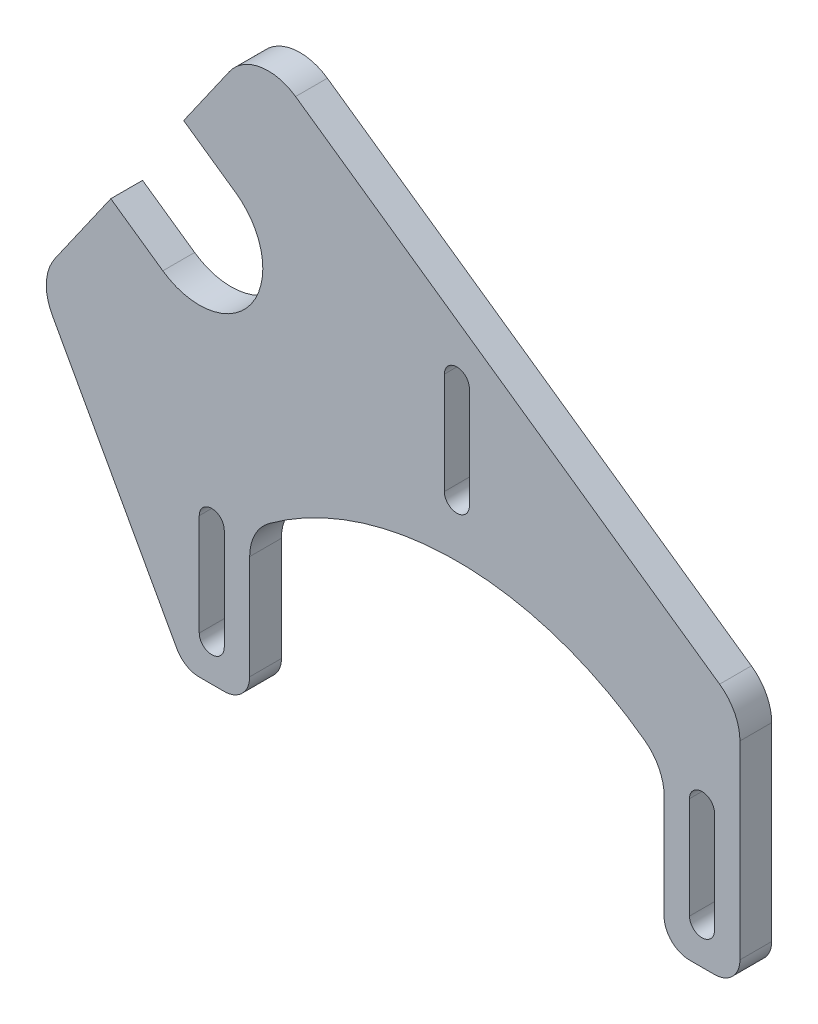
from build123d import *

# Parameters (mm, degrees)
EXTRUDE1_DEPTH     = 6.35
CUT_EXTRUDE3_REACH = 130.919
FILLET1_R          = 9.525


with BuildPart() as part:
    # Sketch1 → Extrude1 (new body)
    with BuildSketch(Plane.XY):
        with BuildLine():
            Line((-41.42, 12.7), (-41.42, -12.7))
            ThreePointArc((-41.42, -12.7), (-42.907897552, -16.292102448), (-46.5, -17.78))
            Line((-46.5, -17.78), (-51.5, -17.78))
            ThreePointArc((-51.5, -17.78), (-54.085377818, -17.072896242), (-55.951019269, -15.148433677))
            Line((-55.951019269, -15.148433677), (-83.74924785, 35.386098748))
            Line((-83.74924785, 35.386098748), (-69.180406366, 56.192560673))
            Line((-69.180406366, 56.192560673), (-58.777175404, 48.908139931))
            ThreePointArc((-58.777175404, 48.908139931), (-41.0895237, 52.026950152), (-44.208333921, 69.714601856))
            Line((-44.208333921, 69.714601856), (-54.611564883, 76.999022598))
            Line((-54.611564883, 76.999022598), (-40.0427234, 97.805484523))
            Line((-40.0427234, 97.805484523), (56.58, 30.149525236))
            Line((56.58, 30.149525236), (56.58, -12.7))
            ThreePointArc((56.58, -12.7), (55.092102448, -16.292102448), (51.5, -17.78))
            Line((51.5, -17.78), (46.5, -17.78))
            ThreePointArc((46.5, -17.78), (42.907897552, -16.292102448), (41.42, -12.7))
            Line((41.42, -12.7), (41.42, 12.7))
            ThreePointArc((41.42, 12.7), (0, 28.068579909), (-41.42, 12.7))
        make_face()
    extrude(amount=EXTRUDE1_DEPTH)

    # Sketch4 → Cut-Extrude3 (cut, up to next)
    with BuildSketch(Plane.XY.offset(6.35), mode=Mode.PRIVATE) as cut_extrude3_sk1:
        with BuildLine():
            Line((-51.5, -10.16), (-51.5, 10.16))
            ThreePointArc((-51.5, 10.16), (-49, 12.66), (-46.5, 10.16))
            Line((-46.5, 10.16), (-46.5, -10.16))
            ThreePointArc((-46.5, -10.16), (-49, -12.66), (-51.5, -10.16))
        make_face()
    cut_extrude3_tool1 = extrude(cut_extrude3_sk1.sketch, amount=-CUT_EXTRUDE3_REACH, mode=Mode.PRIVATE) & part.part
    # Sketch4 → Cut-Extrude3 (cut, up to next)
    with BuildSketch(Plane.XY.offset(6.35), mode=Mode.PRIVATE) as cut_extrude3_sk2:
        with BuildLine():
            Line((2.5, 38.84), (2.5, 59.16))
            ThreePointArc((2.5, 59.16), (0, 61.66), (-2.5, 59.16))
            Line((-2.5, 59.16), (-2.5, 38.84))
            ThreePointArc((-2.5, 38.84), (0, 36.34), (2.5, 38.84))
        make_face()
    cut_extrude3_tool2 = extrude(cut_extrude3_sk2.sketch, amount=-CUT_EXTRUDE3_REACH, mode=Mode.PRIVATE) & part.part
    # Sketch4 → Cut-Extrude3 (cut, up to next)
    with BuildSketch(Plane.XY.offset(6.35), mode=Mode.PRIVATE) as cut_extrude3_sk3:
        with BuildLine():
            Line((51.5, -10.16), (51.5, 10.16))
            ThreePointArc((51.5, 10.16), (49, 12.66), (46.5, 10.16))
            Line((46.5, 10.16), (46.5, -10.16))
            ThreePointArc((46.5, -10.16), (49, -12.66), (51.5, -10.16))
        make_face()
    cut_extrude3_tool3 = extrude(cut_extrude3_sk3.sketch, amount=-CUT_EXTRUDE3_REACH, mode=Mode.PRIVATE) & part.part
    add(cut_extrude3_tool1.solids().sort_by_distance((-49, 0, 6.35))[0], mode=Mode.SUBTRACT)
    add(cut_extrude3_tool2.solids().sort_by_distance((0, 49, 6.35))[0], mode=Mode.SUBTRACT)
    add(cut_extrude3_tool3.solids().sort_by_distance((49, 0, 6.35))[0], mode=Mode.SUBTRACT)

    # Fillet1
    fillet1_edges = [part.edges().sort_by_distance(p)[0] for p in [
        (56.58, 30.149525236, 3.175),
        (41.42, 12.7, 3.175),
        (-41.42, 12.7, 3.175),
        (-83.74924785, 35.386098748, 3.175),
        (-40.0427234, 97.805484523, 3.175),
    ]]
    fillet(fillet1_edges, radius=FILLET1_R)


solid = part.part
